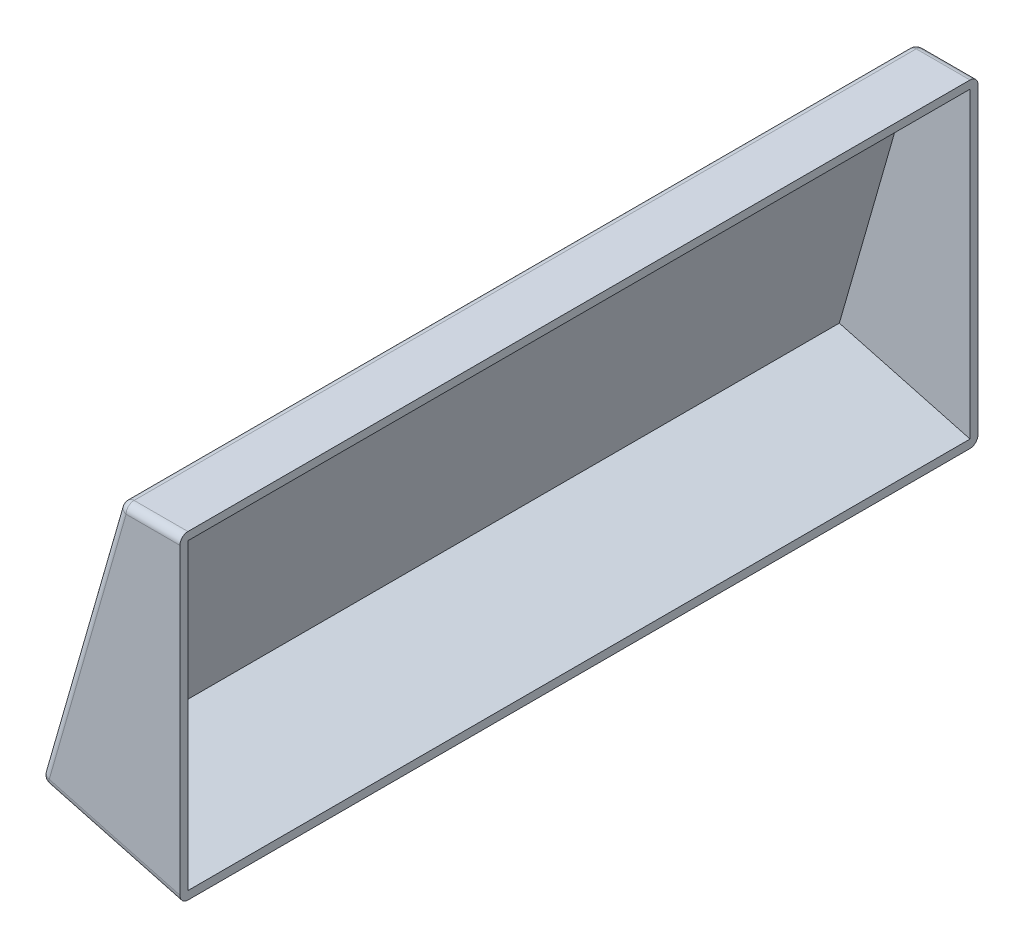
from build123d import *

# Parameters (mm, degrees)
FILLET2_R    = 2
SHELL2_START = -198
SHELL2_DEPTH = 196


# Read off the part's stored shape, not the designer's step: Shell2
with BuildPart() as part:
    # Sweep2: sweep along a path in Sketch6
    with BuildLine(Plane(origin=(0, 62.593086106, 0), x_dir=(1, 0, 0), z_dir=(0, 1, 0))) as sweep2_path:
        Line((-20, 0), (-20, 200))
    # Sketch5 → Sweep2 (sweep)
    with BuildSketch(Plane.XY):
        Polygon((-20, -17.406913894), (-20, 62.593086106), (-35, 62.593086106), (-55.232597818, -7.966367761), align=None)
    sweep(path=sweep2_path.line)

    # Fillet2
    fillet2_edges = [part.edges().sort_by_distance(p)[0] for p in [
        (-27.5, 62.593086106, 0),
        (-45.116298909, 27.313359172, 0),
        (-55.232597818, -7.966367761, -100),
        (-37.616298909, -12.686640828, -200),
        (-27.5, 62.593086106, -200),
        (-35, 62.593086106, -100),
        (-45.116298909, 27.313359172, -200),
        (-37.616298909, -12.686640828, 0),
    ]]
    fillet(fillet2_edges, radius=FILLET2_R)

    # Shell2 outline → Shell2 (cut)
    with BuildSketch(Plane.XY.offset(SHELL2_START)):
        Polygon((-52.749093204, -6.561268456), (-20, -15.336361533), (-20, 60.593086106), (-33.4928919, 60.593086106), align=None)
    extrude(amount=SHELL2_DEPTH, mode=Mode.SUBTRACT)


solid = part.part
